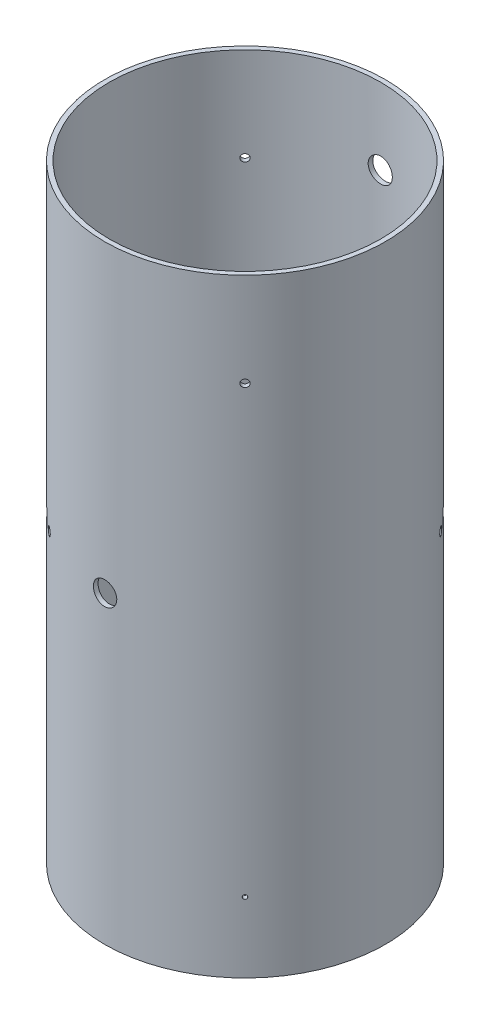
from build123d import *

# Parameters (mm, degrees)
SKETCH1_R               = 76.1746
SKETCH1_R_2             = 73.66
BOSS_EXTRUDE1_DEPTH     = 330.2
CUT_EXTRUDE1_DEPTH      = 348.328633238
CUT_EXTRUDE1_DEPTH_BACK = 348.328633238
SKETCH27_R              = 6.35
CUT_EXTRUDE2_DEPTH      = 348.328633238
CUT_EXTRUDE2_DEPTH_BACK = 348.328633238
SKETCH30_R              = 2.18313
SKETCH30_W              = 9.906
SKETCH30_H              = 9.906
SKETCH23_R              = 1.0922
SHEAR_SCRREWS_DEPTH     = 348.328633238
CIRPATTERN1_COUNT       = 4
CIRPATTERN2_COUNT       = 4


with BuildPart() as part:
    # Sketch1 → Boss-Extrude1 (new body)
    with BuildSketch(Plane(origin=(0, 0, 0), x_dir=(1, 0, 0), z_dir=(0, 1, 0))):
        Circle(SKETCH1_R)
        Circle(SKETCH1_R_2, mode=Mode.SUBTRACT)
    extrude(amount=BOSS_EXTRUDE1_DEPTH)

    # Sketch17 → 1/2 Clearance Hole5 (revolve, cut)
    with BuildSketch(Plane(origin=(0, 288.925, 0), x_dir=(0, -1, 0), z_dir=(1, 0, 0))):
        Polygon((0, 0), (0, 80.134507437), (6.54812, 76.2), (6.54812, 0), align=None)
    revolve(axis=Axis((0, 288.925, 6.35), (0, 0, -1)), mode=Mode.SUBTRACT)

    # Sketch27 → Cut-Extrude1 (cut, two sides: drawn at the far end of the back side and taken through both)
    with BuildSketch(Plane.XY.offset(-CUT_EXTRUDE1_DEPTH_BACK)):
        with Locations((0, 165.1)):
            Circle(SKETCH27_R)
    extrude(amount=CUT_EXTRUDE1_DEPTH + CUT_EXTRUDE1_DEPTH_BACK, mode=Mode.SUBTRACT)

    # Sketch30 → Cut-Extrude2 (cut, two sides: drawn at the far end of the back side and taken through both)
    with BuildSketch(Plane(origin=(0, 0, 0), x_dir=(0.7071067811865477, 0, 0.7071067811865475), z_dir=(-0.7071067811865475, 0, 0.7071067811865477)).offset(-CUT_EXTRUDE2_DEPTH_BACK)):
        with Locations((-12.7, 165.1)):
            Circle(SKETCH30_R)
        with Locations((12.7, 165.1)):
            Circle(SKETCH30_R)
        with Locations((0, 165.1)):
            Rectangle(SKETCH30_W, SKETCH30_H)
    extrude(amount=CUT_EXTRUDE2_DEPTH + CUT_EXTRUDE2_DEPTH_BACK, mode=Mode.SUBTRACT)

    # Sketch23 → Shear Scrrews (cut, through all)
    with BuildSketch(Plane(origin=(0, 0, 0), x_dir=(0.7071067811865477, 0, 0.7071067811865475), z_dir=(-0.7071067811865475, 0, 0.7071067811865477))):
        with Locations((0, 38.1)):
            Circle(SKETCH23_R)
    shear_scrrews = extrude(amount=-SHEAR_SCRREWS_DEPTH, mode=Mode.SUBTRACT)

    # CirPattern1: Shear Scrrews ×4 about axis
    cirpattern1_axis = Axis((0, 330.2, 0), (0, -1, 0))
    for i in range(1, CIRPATTERN1_COUNT):
        add(shear_scrrews.rotate(cirpattern1_axis, i * 360 / CIRPATTERN1_COUNT), mode=Mode.SUBTRACT)

    # Sketch25 → Ø4.0 (4) Diameter Hole1 (revolve, cut)
    with BuildSketch(Plane(origin=(0, 279.4, 0), x_dir=(-0.7071067811865464, 0, -0.7071067811865488), z_dir=(0, 1, 0))):
        Polygon((0, 0), (0, 90.101721238), (2, 88.9), (2, 0), align=None)
    f_4_0_4_diameter_hole1 = revolve(axis=Axis((4.490128061, 279.4, -4.490128061), (-0.7071067811865487, 0, 0.7071067811865464)), mode=Mode.SUBTRACT)

    # CirPattern2: Ø4.0 (4) Diameter Hole1 ×4 about axis
    cirpattern2_axis = Axis((0, 330.2, 0), (0, 1, 0))
    for i in range(1, CIRPATTERN2_COUNT):
        add(f_4_0_4_diameter_hole1.rotate(cirpattern2_axis, i * 360 / CIRPATTERN2_COUNT), mode=Mode.SUBTRACT)


solid = part.part
